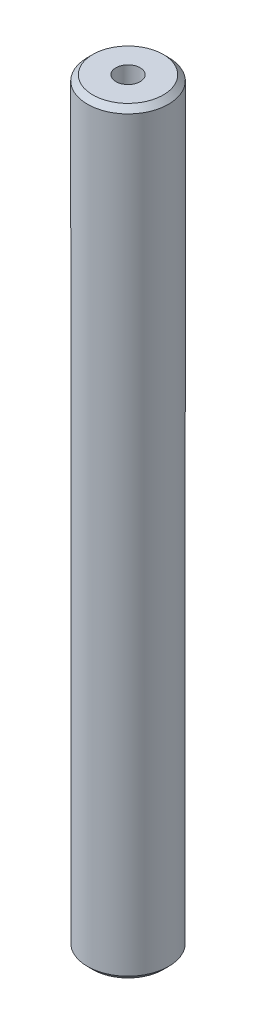
from build123d import *

# Parameters (mm, degrees)
SKETCH1_R           = 22.5
BOSS_EXTRUDE1_DEPTH = 420.620936984
SKETCH2_R           = 6.727665164
CUT_EXTRUDE1_DEPTH  = 422.822797664
CHAMFER1_SIZE       = 2.968533468


with BuildPart() as part:
    # Sketch1 → Boss-Extrude1 (new body)
    with BuildSketch(Plane(origin=(0, 0, 0), x_dir=(1, 0, 0), z_dir=(0, 1, 0))):
        Circle(SKETCH1_R)
    extrude(amount=BOSS_EXTRUDE1_DEPTH)

    # Sketch2 → Cut-Extrude1 (cut, through all)
    with BuildSketch(Plane(origin=(0, 0, 0), x_dir=(1, 0, 0), z_dir=(0, 1, 0))):
        Circle(SKETCH2_R)
    extrude(amount=CUT_EXTRUDE1_DEPTH, mode=Mode.SUBTRACT)

    # Chamfer1
    chamfer1_edges = [part.edges().sort_by_distance(p)[0] for p in [
        (-22.5, 420.620936984, 0),
        (-22.5, 0, 0),
    ]]
    chamfer(chamfer1_edges, length=CHAMFER1_SIZE)


solid = part.part
